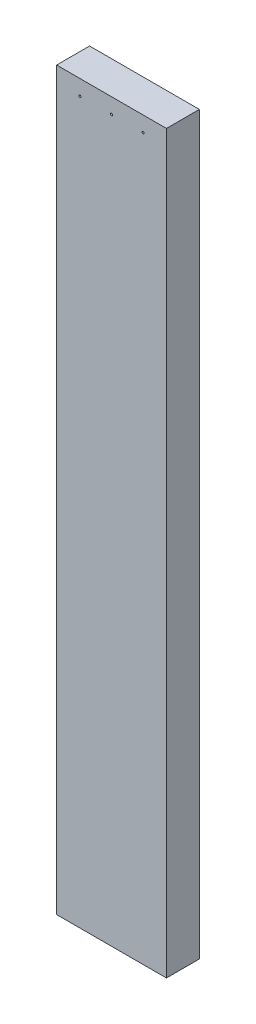
from build123d import *

# Parameters (mm, degrees)
SKETCH2_W               = 63.5
SKETCH2_H               = 19.05
BOSS_EXTRUDE1_DEPTH     = 425.45
CUT_EXTRUDE1_DEPTH      = 431.584318107
CUT_EXTRUDE1_DEPTH_BACK = 50.8
SKETCH3_R               = 0.635
SKETCH4_R               = 0.635
CUT_EXTRUDE2_DEPTH      = 431.584318107


with BuildPart() as part:
    # Sketch2 → Boss-Extrude1 (new body)
    with BuildSketch(Plane(origin=(0, 0, 0), x_dir=(1, 0, 0), z_dir=(0, 1, 0))):
        with Locations((31.75, 9.525)):
            Rectangle(SKETCH2_W, SKETCH2_H)
    extrude(amount=BOSS_EXTRUDE1_DEPTH)

    # Sketch3 → Cut-Extrude1 (cut, two sides: drawn at the far end of the back side and taken through both)
    with BuildSketch(Plane.XZ.offset(-CUT_EXTRUDE1_DEPTH_BACK)):
        with Locations((13.4874, -9.525)):
            Circle(SKETCH3_R)
        with Locations((31.75, -9.525)):
            Circle(SKETCH3_R)
        with Locations((50.0126, -9.525)):
            Circle(SKETCH3_R)
    extrude(amount=CUT_EXTRUDE1_DEPTH + CUT_EXTRUDE1_DEPTH_BACK, mode=Mode.SUBTRACT)

    # Sketch4 → Cut-Extrude2 (cut, through all)
    with BuildSketch(Plane.XY):
        with Locations((31.7246, 416.56)):
            Circle(SKETCH4_R)
        with Locations((50.0126, 416.56)):
            Circle(SKETCH4_R)
        with Locations((13.4366, 416.56)):
            Circle(SKETCH4_R)
    extrude(amount=-CUT_EXTRUDE2_DEPTH, mode=Mode.SUBTRACT)


solid = part.part
